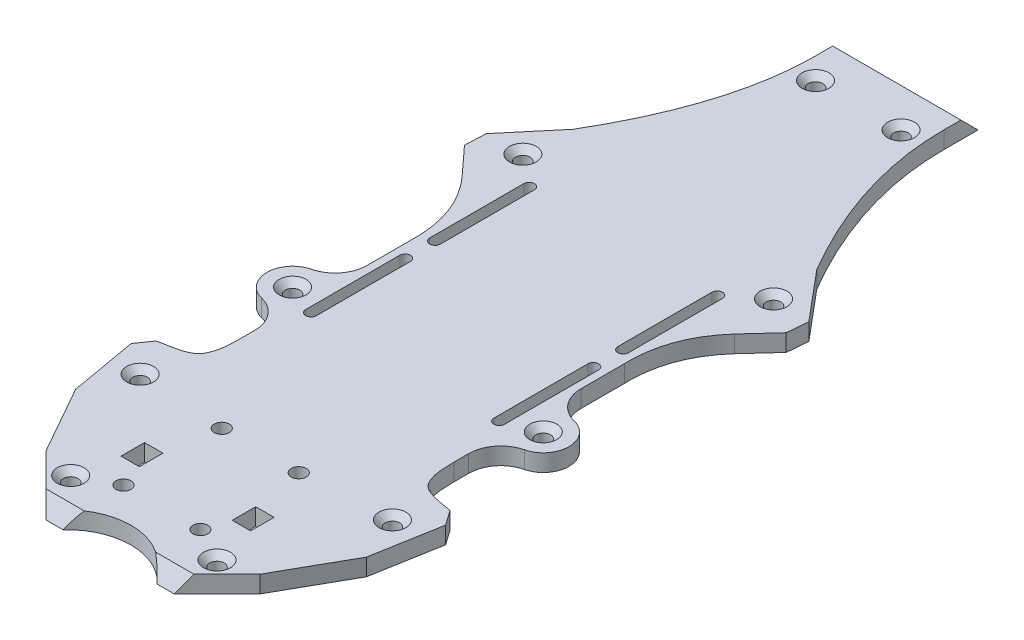
from build123d import *
from OCP.BRepFilletAPI import BRepFilletAPI_MakeChamfer

# Parameters (mm, degrees)
SKETCH1_W                                       = 50
SKETCH1_H                                       = 180
BOSS_EXTRUDE1_DEPTH                             = 4
CHAMFER1_SIZE                                   = 10
CSK_FOR_M3_FLAT_HEAD_MACHINE_SCREW1_D           = 3.4
CSK_FOR_M3_FLAT_HEAD_MACHINE_SCREW1_CSINK_D     = 6.3
CSK_FOR_M3_FLAT_HEAD_MACHINE_SCREW1_CSINK_ANGLE = 90
CSK_FOR_M3_FLAT_HEAD_MACHINE_SCREW2_D           = 3.4
CSK_FOR_M3_FLAT_HEAD_MACHINE_SCREW2_CSINK_D     = 6.3
CSK_FOR_M3_FLAT_HEAD_MACHINE_SCREW2_CSINK_ANGLE = 90
SKETCH8_W                                       = 4.3
SKETCH8_H                                       = 5.5
CUT_EXTRUDE3_DEPTH                              = 94.493315269
CUT_EXTRUDE7_DEPTH                              = 94.493315269
CUT_EXTRUDE8_DEPTH                              = 94.493315269
BOSS_EXTRUDE4_DEPTH                             = 4
BOSS_EXTRUDE5_DEPTH                             = 4
CSK_FOR_M3_FLAT_HEAD_MACHINE_SCREW3_D           = 3.4
CSK_FOR_M3_FLAT_HEAD_MACHINE_SCREW3_CSINK_D     = 6.3
CSK_FOR_M3_FLAT_HEAD_MACHINE_SCREW3_CSINK_ANGLE = 90
CHAMFER6_SIZE                                   = 7
CHAMFER6_SIZE2                                  = 8.629621363
CUT_EXTRUDE10_DEPTH                             = 99.569772243
CHAMFER7_SIZE                                   = 3
CHAMFER7_SIZE2                                  = 3.484649721
CUT_EXTRUDE11_DEPTH                             = 98.803047806
CUT_EXTRUDE12_DEPTH                             = 98.803047941
CUT_EXTRUDE13_DEPTH                             = 98.803047941
SKETCH35_R                                      = 6
BOSS_EXTRUDE6_DEPTH                             = 4
FILLET1_R                                       = 7.5
CSK_FOR_M3_FLAT_HEAD_MACHINE_SCREW4_D           = 3.4
CSK_FOR_M3_FLAT_HEAD_MACHINE_SCREW4_CSINK_D     = 6.3
CSK_FOR_M3_FLAT_HEAD_MACHINE_SCREW4_CSINK_ANGLE = 90
SKETCH38_W                                      = 30
SKETCH38_H                                      = 8
BOSS_EXTRUDE7_DEPTH                             = 4
CHAMFER8_SIZE                                   = 4
CHAMFER9_SIZE                                   = 2.309401077
CHAMFER9_SIZE_2                                 = 4
CUT_EXTRUDE14_DEPTH                             = 106.211388111
F_3_5_3_5_DIAMETER_HOLE3_D                      = 3.5


with BuildPart() as part:
    # Sketch1 → Boss-Extrude1 (new body)
    with BuildSketch(Plane(origin=(0, 0, 0), x_dir=(1, 0, 0), z_dir=(0, 1, 0))):
        Rectangle(SKETCH1_W, SKETCH1_H)
    extrude(amount=BOSS_EXTRUDE1_DEPTH)

    # Chamfer1
    chamfer1_edges = [part.edges().sort_by_distance(p)[0] for p in [
        (-25, 2, -90),
        (25, 2, -90),
        (25, 2, 90),
        (-25, 2, 90),
    ]]
    chamfer(chamfer1_edges, length=CHAMFER1_SIZE)

    # CSK for M3 Flat Head Machine Screw1 (through all)
    with Locations(Plane(origin=(0, 4, 0), x_dir=(1, 0, 0), z_dir=(0, 1, 0))):
        with Locations((17.115004333, -82.115004333), (-17.115004333, -82.115004333)):
            CounterSinkHole(CSK_FOR_M3_FLAT_HEAD_MACHINE_SCREW1_D / 2, CSK_FOR_M3_FLAT_HEAD_MACHINE_SCREW1_CSINK_D / 2, counter_sink_angle=CSK_FOR_M3_FLAT_HEAD_MACHINE_SCREW1_CSINK_ANGLE)

    # CSK for M3 Flat Head Machine Screw2 (through all)
    with Locations(Plane(origin=(0, 4, 0), x_dir=(1, 0, 0), z_dir=(0, 1, 0))):
        with Locations((10, 85), (-10, 85)):
            CounterSinkHole(CSK_FOR_M3_FLAT_HEAD_MACHINE_SCREW2_D / 2, CSK_FOR_M3_FLAT_HEAD_MACHINE_SCREW2_CSINK_D / 2, counter_sink_angle=CSK_FOR_M3_FLAT_HEAD_MACHINE_SCREW2_CSINK_ANGLE)

    # Sketch8 → Cut-Extrude3 (cut, through all)
    with BuildSketch(Plane(origin=(0, 4, 0), x_dir=(1, 0, 0), z_dir=(0, 1, 0))):
        with Locations((13, -69.55)):
            Rectangle(SKETCH8_W, SKETCH8_H)
        with Locations((-13, -69.55)):
            Rectangle(SKETCH8_W, SKETCH8_H)
    extrude(amount=-CUT_EXTRUDE3_DEPTH, mode=Mode.SUBTRACT)

    # Sketch12 → Cut-Extrude7 (cut, through all)
    with BuildSketch(Plane(origin=(0, 4, 0), x_dir=(1, 0, 0), z_dir=(0, 1, 0))):
        with BuildLine():
            Line((20.75, -21), (20.75, 1))
            ThreePointArc((20.75, 1), (22, 2.25), (23.25, 1))
            Line((23.25, 1), (23.25, -21))
            ThreePointArc((23.25, -21), (22, -22.25), (20.75, -21))
        make_face()
        with BuildLine():
            Line((-20.75, -21), (-20.75, 1))
            ThreePointArc((-20.75, 1), (-22, 2.25), (-23.25, 1))
            Line((-23.25, 1), (-23.25, -21))
            ThreePointArc((-23.25, -21), (-22, -22.25), (-20.75, -21))
        make_face()
    extrude(amount=-CUT_EXTRUDE7_DEPTH, mode=Mode.SUBTRACT)

    # Sketch14 → Cut-Extrude8 (cut, through all)
    with BuildSketch(Plane(origin=(0, 4, 0), x_dir=(1, 0, 0), z_dir=(0, 1, 0))):
        with BuildLine():
            Line((-11, -90), (11, -90))
            ThreePointArc((11, -90), (0, -85.133931253), (-11, -90))
        make_face()
    extrude(amount=-CUT_EXTRUDE8_DEPTH, mode=Mode.SUBTRACT)

    # Sketch22 → Boss-Extrude4 (add, through all)
    with BuildSketch(Plane(origin=(0, 4, 0), x_dir=(1, 0, 0), z_dir=(0, 1, 0))):
        Polygon((40, 33.07), (31.85, 24.174468516), (25, 5.354248193), (25, 59.654248193), (28.428767382, 46.857914117), align=None)
        Polygon((-28.428767382, 46.857914117), (-25, 59.654248193), (-25, 5.354248193), (-31.85, 24.174468516), (-40, 33.07), align=None)
    extrude(amount=-BOSS_EXTRUDE4_DEPTH)

    # Sketch25 → Boss-Extrude5 (add, through all)
    with BuildSketch(Plane(origin=(0, 4, 0), x_dir=(1, 0, 0), z_dir=(0, 1, 0))):
        Polygon((25, -43.181298855), (25, -80), (34, -64.061347307), (37.299315376, -45.35), align=None)
        Polygon((-37.299315376, -45.35), (-25, -43.181298855), (-25, -80), (-34, -64.061347307), align=None)
    extrude(amount=-BOSS_EXTRUDE5_DEPTH)

    # CSK for M3 Flat Head Machine Screw3 (through all)
    with Locations(Plane(origin=(0, 4, 0), x_dir=(1, 0, 0), z_dir=(0, 1, 0))):
        with Locations((29.508521961, -53.472963553), (-29.508521961, -53.472963553), (29.320888862, 35.855752194), (-29.320888862, 35.855752194)):
            CounterSinkHole(CSK_FOR_M3_FLAT_HEAD_MACHINE_SCREW3_D / 2, CSK_FOR_M3_FLAT_HEAD_MACHINE_SCREW3_CSINK_D / 2, counter_sink_angle=CSK_FOR_M3_FLAT_HEAD_MACHINE_SCREW3_CSINK_ANGLE)

    # Chamfer6: one chamfer whose edges measure the first distance from different faces: ONE call of the kernel's chamfer builder (chamfer() names one face for all edges)
    chamfer6_edges_1 = [part.edges().sort_by_distance(p)[0] for p in [
        (25, 2, 43.181298855),
    ]]
    chamfer6_side_1 = [part.faces().sort_by_distance(p)[0] for p in [
        (31.149657688, 2, 44.265649428),
    ]]
    chamfer6_edges_2 = [part.edges().sort_by_distance(p)[0] for p in [
        (-25, 2, 43.181298855),
    ]]
    chamfer6_side_2 = [part.faces().sort_by_distance(p)[0] for p in [
        (-31.149657688, 2, 44.265649428),
    ]]
    chamfer6 = BRepFilletAPI_MakeChamfer(part.part.solid().wrapped)
    for e in chamfer6_edges_1:
        chamfer6.Add(CHAMFER6_SIZE, CHAMFER6_SIZE2, e.wrapped, chamfer6_side_1[0].wrapped)  # the first distance lies on this face
    for e in chamfer6_edges_2:
        chamfer6.Add(CHAMFER6_SIZE, CHAMFER6_SIZE2, e.wrapped, chamfer6_side_2[0].wrapped)  # the first distance lies on this face
    add(Compound.cast(chamfer6.Shape()), mode=Mode.REPLACE)

    # Sketch28 → Cut-Extrude10 (cut, through all)
    with BuildSketch(Plane(origin=(0, 4, 0), x_dir=(1, 0, 0), z_dir=(0, 1, 0))):
        Polygon((25, 59.654248193), (15, 90), (25, 80), align=None)
        Polygon((-25, 80), (-25, 59.654248193), (-15, 90), align=None)
    extrude(amount=-CUT_EXTRUDE10_DEPTH, mode=Mode.SUBTRACT)

    # Chamfer7: one chamfer whose edges measure the first distance from different faces: ONE call of the kernel's chamfer builder (chamfer() names one face for all edges)
    chamfer7_edges_1 = [part.edges().sort_by_distance(p)[0] for p in [
        (40, 2, -33.07),
    ]]
    chamfer7_side_1 = [part.faces().sort_by_distance(p)[0] for p in [
        (34.214383691, 2, -39.963957058),
    ]]
    chamfer7_edges_2 = [part.edges().sort_by_distance(p)[0] for p in [
        (-40, 2, -33.07),
    ]]
    chamfer7_side_2 = [part.faces().sort_by_distance(p)[0] for p in [
        (-35.925, 2, -28.622234258),
    ]]
    chamfer7_edges_3 = [part.edges().sort_by_distance(p)[0] for p in [
        (37.299315376, 2, 45.35),
        (-37.299315376, 2, 45.35),
    ]]
    chamfer7 = BRepFilletAPI_MakeChamfer(part.part.solid().wrapped)
    for e in chamfer7_edges_1:
        chamfer7.Add(CHAMFER7_SIZE, CHAMFER7_SIZE2, e.wrapped, chamfer7_side_1[0].wrapped)  # the first distance lies on this face
    for e in chamfer7_edges_2:
        chamfer7.Add(CHAMFER7_SIZE, CHAMFER7_SIZE2, e.wrapped, chamfer7_side_2[0].wrapped)  # the first distance lies on this face
    for e in chamfer7_edges_3:
        chamfer7.Add(CHAMFER7_SIZE, e.wrapped)
    add(Compound.cast(chamfer7.Shape()), mode=Mode.REPLACE)

    # Sketch29 → Cut-Extrude11 (cut, through all)
    with BuildSketch(Plane(origin=(0, 4, 0), x_dir=(1, 0, 0), z_dir=(0, 1, 0))):
        with BuildLine():
            Line((15, 90), (25, 59.654248193))
            Line((25, 59.654248193), (28.428767382, 46.857914117))
            add(Edge.make_bspline(
                [(28.428767382, 46.857914117), (20.790254016, 59.905991383), (15, 74.574295018), (15, 90)],
                knots=[0, 0, 0, 0, 1, 1, 1, 1], degree=3))
        make_face()
        with BuildLine():
            Line((-25, 59.654248193), (-28.428767382, 46.857914117))
            add(Edge.make_bspline(
                [(-28.428767382, 46.857914117), (-20.790254016, 59.905991383), (-15, 74.574295018), (-15, 90)],
                knots=[0, 0, 0, 0, 1, 1, 1, 1], degree=3))
            Line((-15, 90), (-25, 59.654248193))
        make_face()
    extrude(amount=-CUT_EXTRUDE11_DEPTH, mode=Mode.SUBTRACT)

    # Sketch30 → Cut-Extrude12 (cut, through all)
    with BuildSketch(Plane(origin=(0, 4, 0), x_dir=(1, 0, 0), z_dir=(0, 1, 0))):
        with BuildLine():
            Line((31.85, 24.174468516), (25, 5.354248193))
            add(Edge.make_bspline(
                [(25, 5.354248193), (24.666229517, 16.132438928), (31.85, 24.174468516)],
                knots=[0, 0, 0, 1, 1, 1], degree=2))
        make_face()
        with BuildLine():
            Line((-31.85, 24.174468516), (-25, 5.354248193))
            add(Edge.make_bspline(
                [(-25, 5.354248193), (-24.666229517, 16.132438928), (-31.85, 24.174468516)],
                knots=[0, 0, 0, 1, 1, 1], degree=2))
        make_face()
    extrude(amount=-CUT_EXTRUDE12_DEPTH, mode=Mode.SUBTRACT)

    # Sketch31 → Cut-Extrude13 (cut, through all)
    with BuildSketch(Plane(origin=(0, 4, 0), x_dir=(1, 0, 0), z_dir=(0, 1, 0))):
        with BuildLine():
            Line((25, -34.551677492), (31.893654271, -44.396836099))
            add(Edge.make_bspline(
                [(25, -34.551677492), (25, -38.270129885), (25.741471245, -41.446093621), (27.474541521, -43.61762729), (31.893654271, -44.396836099)],
                knots=[0, 0, 0, 0, 0.5, 1, 1, 1, 1], degree=3))
        make_face()
        with BuildLine():
            Line((-25, -34.551677492), (-31.893654271, -44.396836099))
            add(Edge.make_bspline(
                [(-25, -34.551677492), (-25, -38.270129885), (-25.741471245, -41.446093621), (-27.474541521, -43.61762729), (-31.893654271, -44.396836099)],
                knots=[0, 0, 0, 0, 0.5, 1, 1, 1, 1], degree=3))
        make_face()
    extrude(amount=-CUT_EXTRUDE13_DEPTH, mode=Mode.SUBTRACT)

    # Sketch35 → Boss-Extrude6 (add, through all)
    with BuildSketch(Plane(origin=(0, 4, 0), x_dir=(1, 0, 0), z_dir=(0, 1, 0))):
        with Locations((-29.320888862, -18.004247806)):
            Circle(SKETCH35_R)
        with BuildLine():
            Line((-25, -12.004247806), (-29.320888862, -12.004247806))
            ThreePointArc((-29.320888862, -12.004247806), (-26.973287097, -12.482584474), (-25, -13.841325823))
            Line((-25, -13.841325823), (-25, -12.004247806))
        make_face()
        with BuildLine():
            Line((-29.320888862, -24.004247806), (-25, -24.004247806))
            Line((-25, -24.004247806), (-25, -22.16716979))
            ThreePointArc((-25, -22.16716979), (-26.973287097, -23.525911138), (-29.320888862, -24.004247806))
        make_face()
        with Locations((29.320888862, -18.004247806)):
            Circle(SKETCH35_R)
        with BuildLine():
            ThreePointArc((25, -13.841325823), (26.973287097, -12.482584474), (29.320888862, -12.004247806))
            Line((29.320888862, -12.004247806), (25, -12.004247806))
            Line((25, -12.004247806), (25, -13.841325823))
        make_face()
        with BuildLine():
            Line((25, -24.004247806), (29.320888862, -24.004247806))
            ThreePointArc((29.320888862, -24.004247806), (26.973287097, -23.525911138), (25, -22.16716979))
            Line((25, -22.16716979), (25, -24.004247806))
        make_face()
    extrude(amount=-BOSS_EXTRUDE6_DEPTH)

    # Fillet1
    fillet1_edges = [part.edges().sort_by_distance(p)[0] for p in [
        (-25, 2, 12.004247806),
        (-25, 2, 24.004247806),
        (25, 2, 24.004247806),
        (25, 2, 12.004247806),
    ]]
    fillet(fillet1_edges, radius=FILLET1_R)

    # CSK for M3 Flat Head Machine Screw4 (through all)
    with Locations(Plane(origin=(0, 4, 0), x_dir=(1, 0, 0), z_dir=(0, 1, 0))):
        with Locations((29.320888862, -18.004247806), (-29.320888862, -18.004247806)):
            CounterSinkHole(CSK_FOR_M3_FLAT_HEAD_MACHINE_SCREW4_D / 2, CSK_FOR_M3_FLAT_HEAD_MACHINE_SCREW4_CSINK_D / 2, counter_sink_angle=CSK_FOR_M3_FLAT_HEAD_MACHINE_SCREW4_CSINK_ANGLE)

    # Sketch38 → Boss-Extrude7 (add, through all)
    with BuildSketch(Plane(origin=(0, 4, 0), x_dir=(1, 0, 0), z_dir=(0, 1, 0))):
        with Locations((0, 94)):
            Rectangle(SKETCH38_W, SKETCH38_H)
    extrude(amount=-BOSS_EXTRUDE7_DEPTH)

    # Chamfer8
    chamfer8_edges = [part.edges().sort_by_distance(p)[0] for p in [
        (0, 4, -98),
    ]]
    chamfer(chamfer8_edges, length=CHAMFER8_SIZE - 0.0001)  # a hair under: the kernel refuses the full size

    # Chamfer9
    chamfer9_edges_1 = [part.edges().sort_by_distance(p)[0] for p in [
        (13, 4, 90),
    ]]
    chamfer9_side_1 = [part.faces().sort_by_distance(p)[0] for p in [
        (13, 4, 89.953811978),
    ]]
    chamfer9_edges_2 = [part.edges().sort_by_distance(p)[0] for p in [
        (-13, 4, 90),
    ]]
    chamfer9_side_2 = [part.faces().sort_by_distance(p)[0] for p in [
        (-13, 4, 89.953811978),
    ]]
    chamfer9 = BRepFilletAPI_MakeChamfer(part.part.solid().wrapped)
    for e in chamfer9_edges_1:
        chamfer9.Add(CHAMFER9_SIZE - 0.0001, CHAMFER9_SIZE_2 - 0.0001, e.wrapped, chamfer9_side_1[0].wrapped)
    for e in chamfer9_edges_2:
        chamfer9.Add(CHAMFER9_SIZE - 0.0001, CHAMFER9_SIZE_2 - 0.0001, e.wrapped, chamfer9_side_2[0].wrapped)
    add(Compound.cast(chamfer9.Shape()), mode=Mode.REPLACE)  # a hair under: the kernel refuses the full size

    # Sketch41 → Cut-Extrude14 (cut, through all)
    with BuildSketch(Plane(origin=(0, 4, 0), x_dir=(1, 0, 0), z_dir=(0, 1, 0))):
        with BuildLine():
            Line((20.75, 8), (20.75, 30))
            ThreePointArc((20.75, 30), (22, 31.25), (23.25, 30))
            Line((23.25, 30), (23.25, 8))
            ThreePointArc((23.25, 8), (22, 6.75), (20.75, 8))
        make_face()
        with BuildLine():
            Line((-20.75, 8), (-20.75, 30))
            ThreePointArc((-20.75, 30), (-22, 31.25), (-23.25, 30))
            Line((-23.25, 30), (-23.25, 8))
            ThreePointArc((-23.25, 8), (-22, 6.75), (-20.75, 8))
        make_face()
    extrude(amount=-CUT_EXTRUDE14_DEPTH, mode=Mode.SUBTRACT)

    # Ø3.5 (3.5) Diameter Hole3 (through all)
    with Locations(Plane(origin=(0, 4, 0), x_dir=(1, 0, 0), z_dir=(0, 1, 0))):
        with Locations((-9, -54.885582313), (-9, -77.885582313), (9, -77.885582313), (9, -54.885582313)):
            Hole(F_3_5_3_5_DIAMETER_HOLE3_D / 2)


solid = part.part
